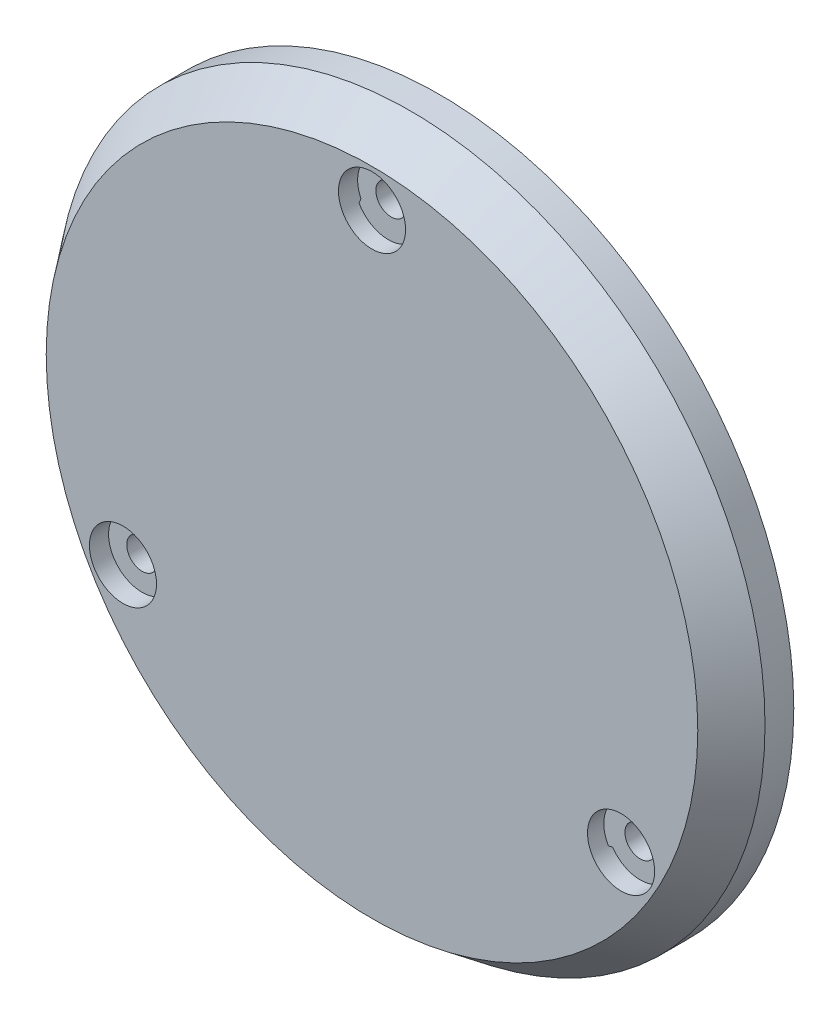
from build123d import *
from build123d.topology import SkipClean

# Parameters (mm, degrees)
SKETCH_1_R          = 37
EXTRUDE_1_DEPTH     = 4
EXTRUDE_1_TAPER     = 37
SKETCH_2_R          = 35
SKETCH_2_R_2        = 30
EXTRUDE_2_DEPTH     = 2
CUT_EXTRUDE_START   = -2
SKETCH_3_R          = 35
SKETCH_3_R_2        = 32.9
CUT_EXTRUDE_1_DEPTH = 2
SKETCH_4_R          = 30
CUT_EXTRUDE_2_DEPTH = 2.3
CUT_EXTRUDE_2_DRAFT = -34
SKETCH_5_R          = 1.6
CUT_EXTRUDE_3_DEPTH = 53.668776329
SKETCH_6_R          = 48.298599652
CUT_EXTRUDE_4_DEPTH = 2
SKETCH_7_R          = 1.6
EXTRUDE_3_DEPTH     = 2
SKETCH_8_R          = 3.5
CUT_EXTRUDE_5_DEPTH = 2
SKETCH_9_R          = 37
SKETCH_9_R_2        = 35.75
EXTRUDE_4_DEPTH     = 3
FILLET_2_R          = 1
CHAMFER_1_SIZE      = 0.4
CHAMFER_2_SIZE      = 0.4


with BuildPart() as part:
    # Эскиз1 → Бобышка-Вытянуть1 (new body)
    with BuildSketch(Plane.XY):
        Circle(SKETCH_1_R)
    extrude(amount=EXTRUDE_1_DEPTH, taper=EXTRUDE_1_TAPER)

    # Эскиз2 → Бобышка-Вытянуть2 (add)
    with BuildSketch(Plane(origin=(0, 0, 0), x_dir=(-1, 0, 0), z_dir=(0, 0, -1))):
        with Locations(Location((0, 0, 0), (0, 0, 180))):
            Circle(SKETCH_2_R)
        Circle(SKETCH_2_R_2, mode=Mode.SUBTRACT)
    extrude(amount=EXTRUDE_2_DEPTH)

    # Эскиз3 → Вырез-Вытянуть1 (cut)
    with BuildSketch(Plane(origin=(0, 0, -2), x_dir=(-1, 0, 0), z_dir=(0, 0, -1)).offset(CUT_EXTRUDE_START)):
        Circle(SKETCH_3_R)
        Circle(SKETCH_3_R_2, mode=Mode.SUBTRACT)
    extrude(amount=CUT_EXTRUDE_1_DEPTH, mode=Mode.SUBTRACT)


with BuildPart() as cut_extrude_2_tool:
    # Эскиз4 → Вырез-Вытянуть2 (with draft: the straight prism first)
    with BuildSketch(Plane(origin=(0, 0, 0), x_dir=(-1, 0, 0), z_dir=(0, 0, -1))):
        Circle(SKETCH_4_R)
    extrude(amount=-CUT_EXTRUDE_2_DEPTH)
    # Вырез-Вытянуть2: the draft: its side faces are tilted about the plane it starts from
    cut_extrude_2_sides = [cut_extrude_2_tool.faces().sort_by_distance(p)[0] for p in [
        (30, 0, 1.15),
    ]]
    draft(cut_extrude_2_sides, Plane(origin=(0, 0, 0), x_dir=(-1, 0, 0), z_dir=(0, 0, -1)), CUT_EXTRUDE_2_DRAFT)


with BuildPart() as part_1:
    add(part.part)

    # Вырез-Вытянуть2: cut by cut_extrude_2_tool
    add(cut_extrude_2_tool.part, mode=Mode.SUBTRACT)

    # Эскиз5 → Вырез-Вытянуть3 (cut, through all)
    with BuildSketch(Plane(origin=(0, 0, -2), x_dir=(-1, 0, 0), z_dir=(0, 0, -1))):
        with Locations((0, 30)):
            Circle(SKETCH_5_R)
        with Locations((25.980762114, -15)):
            Circle(SKETCH_5_R)
        with Locations((-25.980762114, -15)):
            Circle(SKETCH_5_R)
    extrude(amount=-CUT_EXTRUDE_3_DEPTH, mode=Mode.SUBTRACT)

    # Эскиз6 → Вырез-Вытянуть4 (cut)
    with BuildSketch(Plane(origin=(0, 0, -2), x_dir=(-1, 0, 0), z_dir=(0, 0, -1))):
        Circle(SKETCH_6_R)
        with BuildLine():
            ThreePointArc((-3.865493606, 28.971428571), (0, 26), (3.865493606, 28.971428571))
            ThreePointArc((3.865493606, 28.971428571), (5.228256401, 30.776743276), (7.464401446, 31.117241379))
            ThreePointArc((7.464401446, 31.117241379), (27.712812921, 16), (30.680522253, -9.094259414))
            ThreePointArc((30.680522253, -9.094259414), (29.267569723, -10.860568777), (27.02273993, -11.138098625))
            ThreePointArc((27.02273993, -11.138098625), (22.516660498, -13), (23.157246324, -17.833329946))
            ThreePointArc((23.157246324, -17.833329946), (24.039313322, -19.916174499), (23.216120807, -22.022981966))
            ThreePointArc((23.216120807, -22.022981966), (0, -32), (-23.216120807, -22.022981966))
            ThreePointArc((-23.216120807, -22.022981966), (-24.039313322, -19.916174499), (-23.157246324, -17.833329946))
            ThreePointArc((-23.157246324, -17.833329946), (-22.516660498, -13), (-27.02273993, -11.138098625))
            ThreePointArc((-27.02273993, -11.138098625), (-29.267569723, -10.860568777), (-30.680522253, -9.094259414))
            ThreePointArc((-30.680522253, -9.094259414), (-27.712812921, 16), (-7.464401446, 31.117241379))
            ThreePointArc((-7.464401446, 31.117241379), (-5.228256401, 30.776743276), (-3.865493606, 28.971428571))
        make_face(mode=Mode.SUBTRACT)
    extrude(amount=-CUT_EXTRUDE_4_DEPTH, mode=Mode.SUBTRACT)

    # Эскиз7 → Бобышка-Вытянуть3 (add)
    # profile 1 of 3: a face of its own
    with SkipClean():  # the faces are left unmerged after this step: merging them gives an invalid solid
        with BuildSketch(Plane(origin=(0, 0, 0), x_dir=(-1, 0, 0), z_dir=(0, 0, -1))):
            with BuildLine():
                ThreePointArc((-4.06066449, 32.033348311), (0, 25.458689456), (4.06066449, 32.033348311))
                ThreePointArc((4.06066449, 32.033348311), (0, 32.289694953), (-4.06066449, 32.033348311))
            make_face()
            with Locations((0, 30)):
                Circle(SKETCH_7_R, mode=Mode.SUBTRACT)
        # profile 2 of 3: a face of its own
        with BuildSketch(Plane(origin=(0, 0, 0), x_dir=(-1, 0, 0), z_dir=(0, 0, -1))):
            with BuildLine():
                ThreePointArc((29.772025651, -12.500035551), (22.047871816, -12.729344728), (25.711361161, -19.53331276))
                ThreePointArc((25.711361161, -19.53331276), (27.963696109, -16.144847476), (29.772025651, -12.500035551))
            make_face()
            with Locations((25.980762114, -15)):
                Circle(SKETCH_7_R, mode=Mode.SUBTRACT)
        # profile 3 of 3: a face of its own
        with BuildSketch(Plane(origin=(0, 0, 0), x_dir=(-1, 0, 0), z_dir=(0, 0, -1))):
            with BuildLine():
                ThreePointArc((-25.711361161, -19.53331276), (-22.047871816, -12.729344728), (-29.772025651, -12.500035551))
                ThreePointArc((-29.772025651, -12.500035551), (-27.963696109, -16.144847476), (-25.711361161, -19.53331276))
            make_face()
            with Locations((-25.980762114, -15)):
                Circle(SKETCH_7_R, mode=Mode.SUBTRACT)
        extrude(amount=-EXTRUDE_3_DEPTH)

    # Эскиз8 → Вырез-Вытянуть5 (cut)
    with BuildSketch(Plane.XY.offset(4)):
        with Locations((-25.980762114, -15)):
            Circle(SKETCH_8_R)
        with Locations((0, 30)):
            Circle(SKETCH_8_R)
        with Locations((25.980762114, -15)):
            Circle(SKETCH_8_R)
    extrude(amount=-CUT_EXTRUDE_5_DEPTH, mode=Mode.SUBTRACT)

    # Эскиз9 → Бобышка-Вытянуть4 (add)
    with BuildSketch(Plane(origin=(0, 0, 0), x_dir=(-1, 0, 0), z_dir=(0, 0, -1))):
        Circle(SKETCH_9_R)
        Circle(SKETCH_9_R_2, mode=Mode.SUBTRACT)
    extrude(amount=EXTRUDE_4_DEPTH)

    # Скругление2
    # the kernel refuses this fillet: 1 mm, written as the material it takes off along each edge
    with BuildSketch(Plane(origin=(-23.642618952, -18.466904697, -10.9538875), x_dir=(0.6526413615221648, -0.7576669804277436, 0), z_dir=(0, 0, 1))) as fillet_2_piece_1:
        with BuildLine():
            CenterArc((2.924720443, -0.998849918), FILLET_2_R, 92.748170632, 179.999844662)
            ThreePointArc((2.972663972, -1.997699966), (1.155509957, -1.491127473), (0, 0))
            ThreePointArc((0, 0), (1.438387103, -0.034502465), (2.876774206, 0))
        make_face()
    extrude(amount=10.9538875, mode=Mode.SUBTRACT)
    with BuildSketch(Plane(origin=(-27.814118073, -11.241656276, -10.953887512), x_dir=(-0.32983817184500175, 0.9440374888710443, 0), z_dir=(0, 0, 1))) as fillet_2_piece_2:
        with BuildLine():
            CenterArc((2.924720446, 0.998849918), FILLET_2_R, 87.25198461, 179.999844755)
            ThreePointArc((2.972663977, 1.997699966), (1.155509959, 1.491127475), (0, 0))
            ThreePointArc((0, 0), (1.438387105, 0.034502465), (2.876774209, 0))
        make_face()
    extrude(amount=10.953887512, mode=Mode.SUBTRACT)
    with BuildSketch(Plane(origin=(-4.171499121, 29.708560973, -10.953887502), x_dir=(-0.9824795334297418, -0.18637050837425084, 0), z_dir=(0, 0, 1))) as fillet_2_piece_3:
        with BuildLine():
            CenterArc((2.92472044, -0.998849918), FILLET_2_R, 92.748170629, 179.999844576)
            ThreePointArc((2.972663967, -1.997699966), (1.155509955, -1.491127472), (0, 0))
            ThreePointArc((0, 0), (1.438387101, -0.034502465), (2.876774203, 0))
        make_face()
    extrude(amount=10.953887502, mode=Mode.SUBTRACT)
    with BuildSketch(Plane(origin=(4.171499121, 29.708560973, -10.9538875), x_dir=(0.9824795333699458, -0.18637050868947486, 0), z_dir=(0, 0, 1))) as fillet_2_piece_4:
        with BuildLine():
            CenterArc((2.924720459, 0.998849918), FILLET_2_R, 87.251984243, 179.99984511)
            ThreePointArc((2.972663996, 1.997699965), (1.155509967, 1.491127481), (0, 0))
            ThreePointArc((0, 0), (1.438387111, 0.034502465), (2.876774222, 0))
        make_face()
    extrude(amount=10.9538875, mode=Mode.SUBTRACT)
    with BuildSketch(Plane(origin=(23.642618952, -18.466904697, -10.953887543), x_dir=(-0.11908016645541439, -0.9928846428246088, 0), z_dir=(0, 0, 1))) as fillet_2_piece_5:
        with BuildLine():
            CenterArc((2.984629175, -0.802296421), FILLET_2_R, 53.349957385, 179.999844812)
            ThreePointArc((2.387701167, -1.604591226), (1.213095178, -0.773658824), (0, 0))
            ThreePointArc((0, 0), (1.790777505, 0.593110736), (3.58155501, 0))
        make_face()
    extrude(amount=10.953887543, mode=Mode.SUBTRACT)
    with BuildSketch(Plane(origin=(27.814118073, -11.241656276, -10.9538875), x_dir=(0.3298381718829614, 0.9440374888577816, 0), z_dir=(0, 0, 1))) as fillet_2_piece_6:
        with BuildLine():
            CenterArc((2.924720444, -0.998849918), FILLET_2_R, 92.748170633, 179.999844688)
            ThreePointArc((2.972663973, -1.997699966), (1.155509958, -1.491127474), (0, 0))
            ThreePointArc((0, 0), (1.438387104, -0.034502465), (2.876774207, 0))
        make_face()
    extrude(amount=10.9538875, mode=Mode.SUBTRACT)

    # Фаска1
    # the kernel refuses this chamfer: 0.4 mm, written as the material it takes off along each edge
    with BuildSketch(Plane(origin=(0, 0, -2), x_dir=(0.7255039037858694, -0.6882180509049903, 0), z_dir=(0.6882180509049903, 0.7255039037858694, 0))) as chamfer_1_piece_1:
        Polygon((30 + CHAMFER_1_SIZE, 0), (30, -CHAMFER_1_SIZE), (30, 0), align=None)
    chamfer_1_piece_1_solid = revolve(axis=Axis((0, 0, -2), (0, 0, -1)), revolution_arc=93.02156569, mode=Mode.PRIVATE)
    with BuildSketch(Plane(origin=(22.490621017, -21.334759578, -2), x_dir=(-0.725503903786187, 0.6882180509046556, 0), z_dir=(-0.6882180509046556, -0.725503903786187, 0))) as chamfer_1_piece_2:
        Polygon((1, -CHAMFER_1_SIZE), (1 - CHAMFER_1_SIZE, 0), (1, 0), align=None)
    chamfer_1_piece_2_solid = revolve(axis=Axis((22.490621017, -21.334759578, -2), (0, 0, -1)), revolution_arc=179.999844812, mode=Mode.PRIVATE)
    with BuildSketch(Plane(origin=(-22.490621021, -21.334759574, -2), x_dir=(-0.7255057697779075, -0.6882160838130462, 0), z_dir=(0.6882160838130462, -0.7255057697779075, 0))) as chamfer_1_piece_3:
        Polygon((1, -CHAMFER_1_SIZE), (1 - CHAMFER_1_SIZE, 0), (1, 0), align=None)
    chamfer_1_piece_3_solid = revolve(axis=Axis((-22.490621021, -21.334759574, -2), (0, 0, -1)), revolution_arc=179.999844662, mode=Mode.PRIVATE)
    with BuildSketch(Plane(origin=(0, 0, -2), x_dir=(-0.23326236325769723, 0.9724138367420705, 0), z_dir=(0.9724138367420705, 0.23326236325769723, 0))) as chamfer_1_piece_4:
        Polygon((30, CHAMFER_1_SIZE), (30 + CHAMFER_1_SIZE, 0), (30, 0), align=None)
    chamfer_1_piece_4_solid = revolve(axis=Axis((0, 0, -2), (0, 0, 1)), revolution_arc=93.0215657, mode=Mode.PRIVATE)
    with BuildSketch(Plane(origin=(-7.231133261, 30.144828939, -2), x_dir=(-0.23325972543558307, 0.9724144694983289, 0), z_dir=(-0.9724144694983289, -0.23325972543558307, 0))) as chamfer_1_piece_5:
        Polygon((1, -CHAMFER_1_SIZE), (1 - CHAMFER_1_SIZE, 0), (1, 0), align=None)
    chamfer_1_piece_5_solid = revolve(axis=Axis((-7.231133261, 30.144828939, -2), (0, 0, -1)), revolution_arc=179.999844576, mode=Mode.PRIVATE)
    with BuildSketch(Plane(origin=(-29.721754286, -8.810069361, -2), x_dir=(0.9587662673001119, 0.2841957858368249, 0), z_dir=(-0.2841957858368249, 0.9587662673001119, 0))) as chamfer_1_piece_6:
        Polygon((1, -CHAMFER_1_SIZE), (1 - CHAMFER_1_SIZE, 0), (1, 0), align=None)
    chamfer_1_piece_6_solid = revolve(axis=Axis((-29.721754286, -8.810069361, -2), (0, 0, -1)), revolution_arc=179.999844755, mode=Mode.PRIVATE)
    with BuildSketch(Plane(origin=(0, 0, -2), x_dir=(0.23326236388166996, 0.972413836592392, 0), z_dir=(-0.972413836592392, 0.23326236388166996, 0))) as chamfer_1_piece_7:
        Polygon((30, -CHAMFER_1_SIZE), (30 + CHAMFER_1_SIZE, 0), (30, 0), align=None)
    chamfer_1_piece_7_solid = revolve(axis=Axis((0, 0, -2), (0, 0, -1)), revolution_arc=93.021565668, mode=Mode.PRIVATE)
    with BuildSketch(Plane(origin=(29.721754286, -8.810069363, -2), x_dir=(0.9587654969044608, -0.2841983848397845, 0), z_dir=(0.2841983848397845, 0.9587654969044608, 0))) as chamfer_1_piece_8:
        Polygon((1 - CHAMFER_1_SIZE, 0), (1, -CHAMFER_1_SIZE), (1, 0), align=None)
    chamfer_1_piece_8_solid = revolve(axis=Axis((29.721754286, -8.810069363, -2), (0, 0, -1)), revolution_arc=179.999844688, mode=Mode.PRIVATE)
    with BuildSketch(Plane(origin=(7.23113328, 30.144828934, -2), x_dir=(-0.23326236388121982, -0.9724138365925001, 0), z_dir=(0.9724138365925001, -0.23326236388121982, 0))) as chamfer_1_piece_9:
        Polygon((1, -CHAMFER_1_SIZE), (1 - CHAMFER_1_SIZE, 0), (1, 0), align=None)
    chamfer_1_piece_9_solid = revolve(axis=Axis((7.23113328, 30.144828934, -2), (0, 0, -1)), revolution_arc=179.99984511, mode=Mode.PRIVATE)
    with BuildSketch(Plane(origin=(0, 0, -2), x_dir=(-0.7255037752298013, -0.6882181864258646, 0), z_dir=(-0.6882181864258646, 0.7255037752298013, 0))) as chamfer_1_piece_10:
        Polygon((32, CHAMFER_1_SIZE), (32 - CHAMFER_1_SIZE, 0), (32, 0), align=None)
    chamfer_1_piece_10_solid = revolve(axis=Axis((0, 0, -2), (0, 0, 1)), revolution_arc=93.021544275, mode=Mode.PRIVATE)
    with BuildSketch(Plane(origin=(0, 0, -2), x_dir=(0.958766320406154, -0.28419560667759153, 0), z_dir=(-0.28419560667759153, -0.958766320406154, 0))) as chamfer_1_piece_11:
        Polygon((32, CHAMFER_1_SIZE), (32 - CHAMFER_1_SIZE, 0), (32, 0), align=None)
    chamfer_1_piece_11_solid = revolve(axis=Axis((0, 0, -2), (0, 0, 1)), revolution_arc=93.021544275, mode=Mode.PRIVATE)
    with BuildSketch(Plane(origin=(0, 0, -2), x_dir=(-0.2332625451763519, 0.9724137931034559, 0), z_dir=(0.9724137931034559, 0.2332625451763519, 0))) as chamfer_1_piece_12:
        Polygon((32, CHAMFER_1_SIZE), (32 - CHAMFER_1_SIZE, 0), (32, 0), align=None)
    chamfer_1_piece_12_solid = revolve(axis=Axis((0, 0, -2), (0, 0, 1)), revolution_arc=93.021544275, mode=Mode.PRIVATE)
    with BuildSketch(Plane(origin=(-6.76461381, 28.2, -2), x_dir=(-0.23325972543563675, 0.972414469498316, 0), z_dir=(0.972414469498316, 0.23325972543563675, 0))) as chamfer_1_piece_13:
        Polygon((3, CHAMFER_1_SIZE), (3 - CHAMFER_1_SIZE, 0), (3, 0), align=None)
    chamfer_1_piece_13_solid = revolve(axis=Axis((-6.76461381, 28.2, -2), (0, 0, 1)), revolution_arc=0.000166142, mode=Mode.PRIVATE)
    with BuildSketch(Plane(origin=(-27.804223292, -8.241672594, -2), x_dir=(-0.9587663204061734, -0.2841956066775257, 0), z_dir=(-0.2841956066775257, 0.9587663204061734, 0))) as chamfer_1_piece_14:
        Polygon((3, CHAMFER_1_SIZE), (3 - CHAMFER_1_SIZE, 0), (3, 0), align=None)
    chamfer_1_piece_14_solid = revolve(axis=Axis((-27.804223292, -8.241672594, -2), (0, 0, 1)), revolution_arc=0.000165951, mode=Mode.PRIVATE)
    with BuildSketch(Plane(origin=(27.804223292, -8.241672594, -2), x_dir=(0.958765496904526, -0.28419838483956483, 0), z_dir=(-0.28419838483956483, -0.958765496904526, 0))) as chamfer_1_piece_15:
        Polygon((3, CHAMFER_1_SIZE), (3 - CHAMFER_1_SIZE, 0), (3, 0), align=None)
    chamfer_1_piece_15_solid = revolve(axis=Axis((27.804223292, -8.241672594, -2), (0, 0, 1)), revolution_arc=0.000166023, mode=Mode.PRIVATE)
    with BuildSketch(Plane(origin=(6.76461381, 28.2, -2), x_dir=(0.2332625451763703, 0.9724137931034513, 0), z_dir=(0.9724137931034513, -0.2332625451763703, 0))) as chamfer_1_piece_16:
        Polygon((3, CHAMFER_1_SIZE), (3 - CHAMFER_1_SIZE, 0), (3, 0), align=None)
    chamfer_1_piece_16_solid = revolve(axis=Axis((6.76461381, 28.2, -2), (0, 0, 1)), revolution_arc=0.000165573, mode=Mode.PRIVATE)
    with BuildSketch(Plane(origin=(-21.039609482, -19.958327406, -2), x_dir=(-0.725505769777874, -0.6882160838130815, 0), z_dir=(-0.6882160838130815, 0.725505769777874, 0))) as chamfer_1_piece_17:
        Polygon((3, CHAMFER_1_SIZE), (3 - CHAMFER_1_SIZE, 0), (3, 0), align=None)
    chamfer_1_piece_17_solid = revolve(axis=Axis((-21.039609482, -19.958327406, -2), (0, 0, 1)), revolution_arc=0.000166051, mode=Mode.PRIVATE)
    with BuildSketch(Plane(origin=(21.039609482, -19.958327406, -2), x_dir=(0.7255037752297527, -0.6882181864259158, 0), z_dir=(-0.6882181864259158, -0.7255037752297527, 0))) as chamfer_1_piece_18:
        Polygon((3, CHAMFER_1_SIZE), (3 - CHAMFER_1_SIZE, 0), (3, 0), align=None)
    chamfer_1_piece_18_solid = revolve(axis=Axis((21.039609482, -19.958327406, -2), (0, 0, 1)), revolution_arc=0.00016589, mode=Mode.PRIVATE)
    add([chamfer_1_piece_1_solid, chamfer_1_piece_2_solid, chamfer_1_piece_3_solid, chamfer_1_piece_4_solid, chamfer_1_piece_5_solid, chamfer_1_piece_6_solid, chamfer_1_piece_7_solid, chamfer_1_piece_8_solid, chamfer_1_piece_9_solid, chamfer_1_piece_10_solid, chamfer_1_piece_11_solid, chamfer_1_piece_12_solid, chamfer_1_piece_13_solid, chamfer_1_piece_14_solid, chamfer_1_piece_15_solid, chamfer_1_piece_16_solid, chamfer_1_piece_17_solid, chamfer_1_piece_18_solid], mode=Mode.SUBTRACT)

    # Фаска2
    chamfer_2_edges = [part_1.edges().sort_by_distance(p)[0] for p in [
        (35.75, 0, -3),
    ]]
    chamfer(chamfer_2_edges, length=CHAMFER_2_SIZE)


solid = part_1.part
